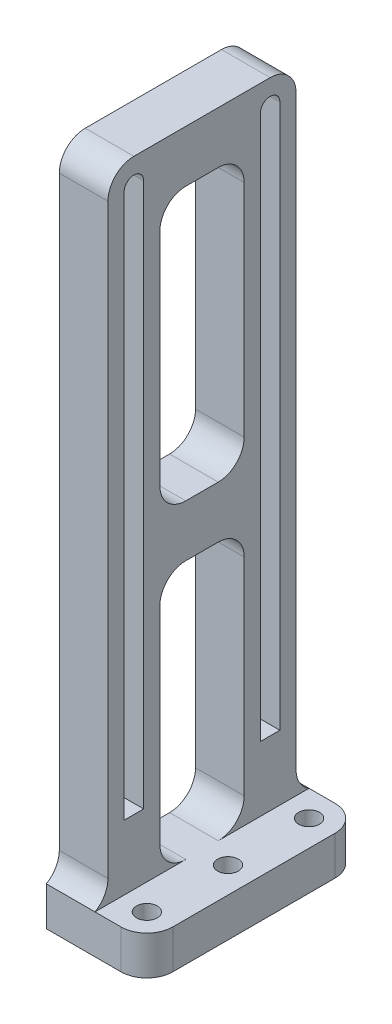
from build123d import *

# Parameters (mm, degrees)
SKETCH1_R           = 1.6
BOSS_EXTRUDE1_DEPTH = 6
SKETCH2_W           = 2.5
SKETCH2_H           = 42
SKETCH2_H_2         = 8
SKETCH2_H_3         = 6
SKETCH2_W_2         = 13
SKETCH2_W_3         = 2
SKETCH2_W_4         = 3
SKETCH2_H_4         = 10
BOSS_EXTRUDE2_DEPTH = 7.5
FILLET3_R           = 4
FILLET4_R           = 4


with BuildPart() as part:
    # Sketch1 → Boss-Extrude1 (new body)
    with BuildSketch(Plane(origin=(0, 0, 0), x_dir=(1, 0, 0), z_dir=(0, 1, 0))):
        with BuildLine():
            Line((-4, -16.5), (0, -16.5))
            ThreePointArc((0, -16.5), (2.828427125, -15.328427125), (4, -12.5))
            Line((4, -12.5), (4, 12.5))
            ThreePointArc((4, 12.5), (2.828427125, 15.328427125), (0, 16.5))
            Line((0, 16.5), (-4, 16.5))
            Line((-4, 16.5), (-4, -16.5))
        make_face()
        with Locations(Location((0, 12.5, 0), (0, 0, 270))):
            Circle(SKETCH1_R, mode=Mode.SUBTRACT)
        with Locations(Location((0, -12.5, 0), (0, 0, 270))):
            Circle(SKETCH1_R, mode=Mode.SUBTRACT)
        with Locations(Location((0, 0, 0), (0, 0, 270))):
            Circle(SKETCH1_R, mode=Mode.SUBTRACT)
    extrude(amount=BOSS_EXTRUDE1_DEPTH)

    # Sketch2 → Boss-Extrude2 (add)
    with BuildSketch(Plane.ZY.offset(4)):
        with BuildLine():
            Line((14.5, 49.877005851), (14.5, 99.877005851))
            ThreePointArc((14.5, 99.877005851), (13.81662479, 97.640937873), (12, 96.168906607))
            Line((12, 96.168906607), (12, 53.585105094))
            ThreePointArc((12, 53.585105094), (13.81662479, 52.113073828), (14.5, 49.877005851))
        make_face()
        with Locations((7.75, 74.877005851)):
            Rectangle(SKETCH2_W, SKETCH2_H)
        with BuildLine():
            ThreePointArc((14.5, 99.877005851), (13.328427125, 102.705432976), (10.5, 103.877005851))
            ThreePointArc((10.5, 103.877005851), (7.671572875, 102.705432976), (6.5, 99.877005851))
            Line((6.5, 99.877005851), (6.5, 95.877005851))
            Line((6.5, 95.877005851), (9, 95.877005851))
            Line((9, 95.877005851), (9, 99.877005851))
            ThreePointArc((9, 99.877005851), (10.5, 101.377005851), (12, 99.877005851))
            Line((12, 99.877005851), (12, 96.168906607))
            ThreePointArc((12, 96.168906607), (13.81662479, 97.640937873), (14.5, 99.877005851))
        make_face()
        with BuildLine():
            Line((10.5, 103.877005851), (-10.5, 103.877005851))
            ThreePointArc((-10.5, 103.877005851), (-7.671572875, 102.705432976), (-6.5, 99.877005851))
            Line((-6.5, 99.877005851), (-6.5, 95.877005851))
            Line((-6.5, 95.877005851), (6.5, 95.877005851))
            Line((6.5, 95.877005851), (6.5, 99.877005851))
            ThreePointArc((6.5, 99.877005851), (7.671572875, 102.705432976), (10.5, 103.877005851))
        make_face()
        with BuildLine():
            ThreePointArc((-10.5, 103.877005851), (-13.328427125, 102.705432976), (-14.5, 99.877005851))
            ThreePointArc((-14.5, 99.877005851), (-13.81662479, 97.640937873), (-12, 96.168906607))
            Line((-12, 96.168906607), (-12, 99.877005851))
            ThreePointArc((-12, 99.877005851), (-10.5, 101.377005851), (-9, 99.877005851))
            Line((-9, 99.877005851), (-9, 95.877005851))
            Line((-9, 95.877005851), (-6.5, 95.877005851))
            Line((-6.5, 95.877005851), (-6.5, 99.877005851))
            ThreePointArc((-6.5, 99.877005851), (-7.671572875, 102.705432976), (-10.5, 103.877005851))
        make_face()
        with BuildLine():
            Line((-14.5, 99.877005851), (-14.5, 49.877005807))
            ThreePointArc((-14.5, 49.877005807), (-13.816624803, 52.11307381), (-12, 53.585105094))
            Line((-12, 53.585105094), (-12, 96.168906607))
            ThreePointArc((-12, 96.168906607), (-13.81662479, 97.640937873), (-14.5, 99.877005851))
        make_face()
        with Locations((-7.75, 74.877005851)):
            Rectangle(SKETCH2_W, SKETCH2_H)
        with Locations((7.75, 49.877005851)):
            Rectangle(SKETCH2_W, SKETCH2_H_2)
        with BuildLine():
            ThreePointArc((12, 46.168906607), (13.81662479, 47.640937873), (14.5, 49.877005851))
            ThreePointArc((14.5, 49.877005851), (13.81662479, 52.113073828), (12, 53.585105094))
            Line((12, 53.585105094), (12, 46.168906607))
        make_face()
        with Locations((-7.75, 49.877005851)):
            Rectangle(SKETCH2_W, SKETCH2_H_2)
        with BuildLine():
            ThreePointArc((-12, 53.585105094), (-13.816624803, 52.11307381), (-14.5, 49.877005807))
            ThreePointArc((-14.5, 49.877005807), (-13.816624778, 47.640937855), (-12, 46.168906607))
            Line((-12, 46.168906607), (-12, 53.585105094))
        make_face()
        with BuildLine():
            Line((-14.5, 49.877005807), (-14.5, 6))
            Line((-14.5, 6), (-12, 6))
            Line((-12, 6), (-12, 16))
            Line((-12, 16), (-12, 46.168906607))
            ThreePointArc((-12, 46.168906607), (-13.816624778, 47.640937855), (-14.5, 49.877005807))
        make_face()
        with BuildLine():
            Line((12, 16), (12, 6))
            Line((12, 6), (14.5, 6))
            Line((14.5, 6), (14.5, 49.877005851))
            ThreePointArc((14.5, 49.877005851), (13.81662479, 47.640937873), (12, 46.168906607))
            Line((12, 46.168906607), (12, 16))
        make_face()
        Polygon((6.5, 45.877005851), (6.5, 6), (9, 6), (9, 16), (9, 45.877005851), align=None)
        with Locations((13.25, 3)):
            Rectangle(SKETCH2_W, SKETCH2_H_3)
        with Locations((7.75, 3)):
            Rectangle(SKETCH2_W, SKETCH2_H_3)
        with Locations((-7.75, 3)):
            Rectangle(SKETCH2_W, SKETCH2_H_3)
        with Locations((-13.25, 3)):
            Rectangle(SKETCH2_W, SKETCH2_H_3)
        Polygon((-9, 6), (-6.5, 6), (-6.5, 45.877005851), (-9, 45.877005851), (-9, 16), align=None)
        with Locations((0, 3)):
            Rectangle(SKETCH2_W_2, SKETCH2_H_3)
        with Locations((-15.5, 3)):
            Rectangle(SKETCH2_W_3, SKETCH2_H_3)
        with Locations((-10.5, 3)):
            Rectangle(SKETCH2_W_4, SKETCH2_H_3)
        with Locations((15.5, 3)):
            Rectangle(SKETCH2_W_3, SKETCH2_H_3)
        with Locations((10.5, 3)):
            Rectangle(SKETCH2_W_4, SKETCH2_H_3)
        with Locations((0, 49.877005851)):
            Rectangle(SKETCH2_W_2, SKETCH2_H_2)
        with Locations((-10.5, 11)):
            Rectangle(SKETCH2_W_4, SKETCH2_H_4)
        with Locations((10.5, 11)):
            Rectangle(SKETCH2_W_4, SKETCH2_H_4)
    extrude(amount=BOSS_EXTRUDE2_DEPTH)

    # Fillet3
    # the kernel refuses this fillet: 4 mm, written as the material it adds along each edge
    with BuildSketch(Plane(origin=(-4, 6, 6.5), x_dir=(0, 0, -1), z_dir=(-1, 0, 0))) as fillet3_piece_1:
        with BuildLine():
            CenterArc((FILLET3_R, -FILLET3_R), FILLET3_R, 90, 90)
            Line((0, -FILLET3_R), (-FILLET3_R * 0.02, -FILLET3_R))
            Line((-FILLET3_R * 0.02, -FILLET3_R), (-FILLET3_R * 0.02, FILLET3_R * 0.02))
            Line((-FILLET3_R * 0.02, FILLET3_R * 0.02), (FILLET3_R, FILLET3_R * 0.02))
            Line((FILLET3_R, FILLET3_R * 0.02), (FILLET3_R, 0))
        make_face()
    extrude(amount=7.5)
    with BuildSketch(Plane(origin=(-4, 6, -14.5), x_dir=(0, 0, -1), z_dir=(-1, 0, 0))) as fillet3_piece_2:
        with BuildLine():
            CenterArc((4, -3.464101615), FILLET3_R, 120, 60)
            Line((0, -3.464101615), (-0.08, -3.464101615))
            Line((-0.08, -3.464101615), (-0.08, 0))
            Line((-0.08, 0), (0, 0.08))
            ThreePointArc((0, 0.08), (1, 0.08), (1.96, 0.069282032))
            Line((1.96, 0.069282032), (2, 0))
        make_face()
    extrude(amount=7.5)
    with BuildSketch(Plane(origin=(-4, 6, 14.5), x_dir=(0, 0, 1), z_dir=(-1, 0, 0))) as fillet3_piece_3:
        with BuildLine():
            CenterArc((4, 3.464101615), FILLET3_R, 180, 60)
            Line((0, 3.464101615), (-0.08, 3.464101615))
            Line((-0.08, 3.464101615), (-0.08, 0))
            Line((-0.08, 0), (0, -0.08))
            ThreePointArc((0, -0.08), (1, -0.08), (1.96, -0.069282032))
            Line((1.96, -0.069282032), (2, 0))
        make_face()
    extrude(amount=7.5)
    with BuildSketch(Plane(origin=(-4, 6, -6.5), x_dir=(0, 0, 1), z_dir=(-1, 0, 0))) as fillet3_piece_4:
        with BuildLine():
            CenterArc((FILLET3_R, FILLET3_R), FILLET3_R, 180, 90)
            Line((0, FILLET3_R), (-FILLET3_R * 0.02, FILLET3_R))
            Line((-FILLET3_R * 0.02, FILLET3_R), (-FILLET3_R * 0.02, -FILLET3_R * 0.02))
            Line((-FILLET3_R * 0.02, -FILLET3_R * 0.02), (FILLET3_R, -FILLET3_R * 0.02))
            Line((FILLET3_R, -FILLET3_R * 0.02), (FILLET3_R, 0))
        make_face()
    extrude(amount=7.5)

    # Fillet4
    fillet4_edges = [part.edges().sort_by_distance(p)[0] for p in [
        (-7.75, 45.877005851, -6.5),
        (-7.75, 45.877005851, 6.5),
        (-7.75, 95.877005851, -6.5),
        (-7.75, 95.877005851, 6.5),
        (-7.75, 53.877005851, 6.5),
        (-7.75, 53.877005851, -6.5),
    ]]
    fillet(fillet4_edges, radius=FILLET4_R)


solid = part.part
